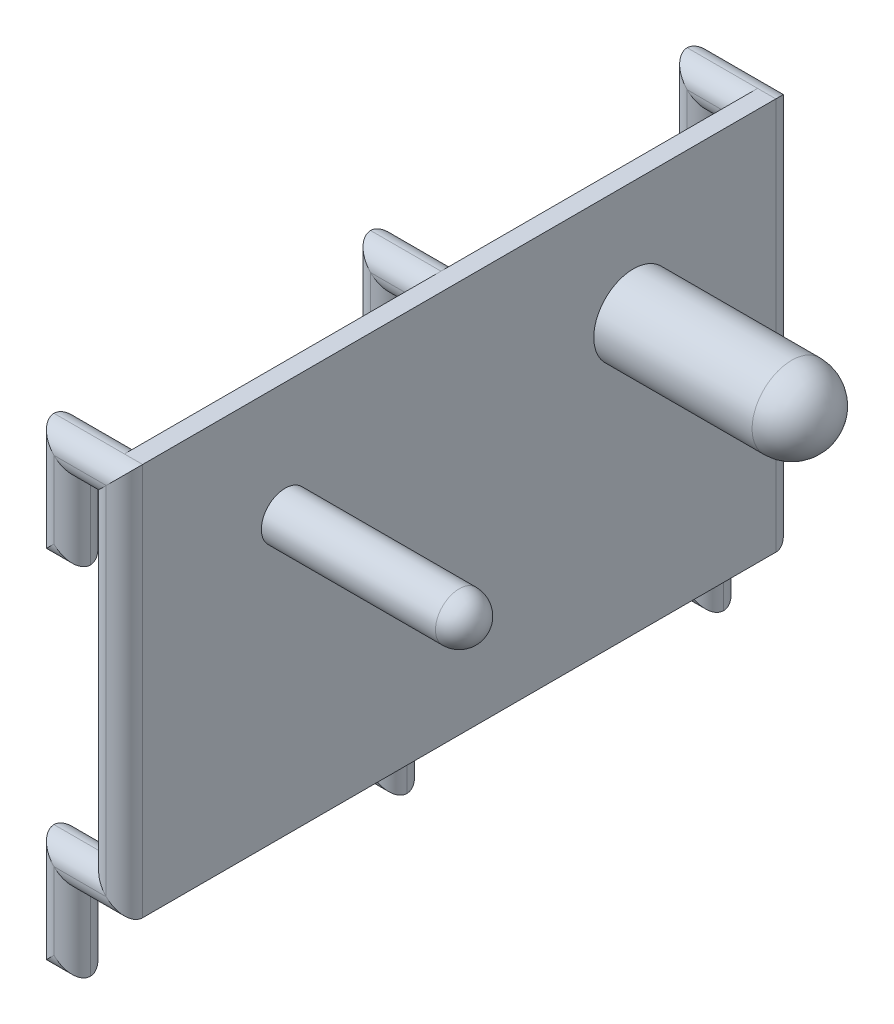
from build123d import *
from OCP.BRepFilletAPI import BRepFilletAPI_MakeFillet

# Parameters (mm, degrees)
EXTRU_MINCE1_DEPTH           = 2.3
CONG_1_R                     = 2.3
ESQUISSE2_W                  = 80
ESQUISSE2_H                  = 49.6
BOSS_EXTRU_1_DEPTH           = 2.3
R_P_TITION_START             = 77.7
R_P_TITION_LIN_AIRE1_DEPTH   = 4.6
R_P_TITION_START_2           = 37.7
R_P_TITION_LIN_AIRE1_2_DEPTH = 4.6
CONG_2_R                     = 2.3
ESQUISSE3_R                  = 3
ESQUISSE3_R_2                = 5
BOSS_EXTRU_2_DEPTH           = 25
CONG_5_R1                    = 3
CONG_5_R2                    = 5


# Read off the part's stored shape, not the designer's step: Répétition linéaire1
with BuildPart() as part:
    # Esquisse1 → Extru.-Mince1 (new, symmetric)
    with BuildSketch(Plane.XY):
        Polygon((-4.3, -57), (-4.3, -47.3), (2.3, -47.3), (2.3, 2.3), (-8.9, 2.3), (-8.9, -12), (-4.3, -12), (-4.3, -2.3), (-2.3, -2.3), (-2.3, -42.7), (-8.9, -42.7), (-8.9, -57), align=None)
    extrude(amount=EXTRU_MINCE1_DEPTH, both=True)

    # Congé1
    cong_1_edges = [part.edges().sort_by_distance(p)[0] for p in [
        (-6.6, -57, -2.3),
        (-4.3, -52.15, -2.3),
        (-1, -47.3, -2.3),
        (2.3, -22.5, -2.3),
        (-3.3, 2.3, -2.3),
        (-8.9, -4.85, -2.3),
        (-6.6, -12, -2.3),
        (-4.3, -7.15, -2.3),
        (-3.3, -2.3, -2.3),
        (-2.3, -22.5, -2.3),
        (-5.6, -42.7, -2.3),
        (-8.9, -49.85, -2.3),
        (-5.6, -42.7, 2.3),
        (-2.3, -22.5, 2.3),
        (-3.3, -2.3, 2.3),
        (-4.3, -7.15, 2.3),
        (-6.6, -12, 2.3),
        (-8.9, -4.85, 2.3),
        (-3.3, 2.3, 2.3),
        (2.3, -22.5, 2.3),
        (-1, -47.3, 2.3),
        (-4.3, -52.15, 2.3),
        (-6.6, -57, 2.3),
        (-8.9, -49.85, 2.3),
    ]]
    fillet(cong_1_edges, radius=CONG_1_R - 0.0001)  # a hair under: the kernel refuses the full size

    # Esquisse2 → Boss.-Extru.1 (add)
    with BuildSketch(Plane(origin=(0, 0, 0), x_dir=(0, 0, -1), z_dir=(1, 0, 0))):
        with Locations((-40, -22.5)):
            Rectangle(ESQUISSE2_W, ESQUISSE2_H)
    extrude(amount=BOSS_EXTRU_1_DEPTH)

    # Répétition linéaire1 outline → Répétition linéaire1 (add)
    with BuildSketch(Plane.XY.offset(R_P_TITION_START)):
        Polygon((-8.9, 2.3), (-8.9, -12), (-4.3, -12), (-4.3, -2.3), (-2.3, -2.3), (-2.3, -42.7), (-8.9, -42.7), (-8.9, -57), (-4.3, -57), (-4.3, -47.3), (2.3, -47.3), (2.3, 2.3), align=None)
    extrude(amount=R_P_TITION_LIN_AIRE1_DEPTH)

    # R_p_tition lin_aire1 2 outline → R_p_tition lin_aire1 2 (add)
    with BuildSketch(Plane.XY.offset(R_P_TITION_START_2)):
        Polygon((0, 2.3), (-8.9, 2.3), (-8.9, -12), (-4.3, -12), (-4.3, -2.3), (-2.3, -2.3), (-2.3, -42.7), (-8.9, -42.7), (-8.9, -57), (-4.3, -57), (-4.3, -47.3), (0, -47.3), align=None)
    extrude(amount=R_P_TITION_LIN_AIRE1_2_DEPTH)

    # Congé2
    cong_2_edges = [part.edges().sort_by_distance(p)[0] for p in [
        (2.3, -22.5, 82.3),
        (-1, -47.3, 82.3),
        (-3.3, 2.3, 82.3),
        (-4.45, 2.3, 77.7),
        (-2.15, -47.3, 77.7),
        (-4.3, -52.15, 77.7),
        (-6.6, -57, 77.7),
        (-6.6, -12, 77.7),
        (-8.9, -4.85, 77.7),
        (-8.9, -49.85, 77.7),
        (-6.6, -57, 82.3),
        (-4.3, -52.15, 82.3),
        (-8.9, -4.85, 82.3),
        (-6.6, -12, 82.3),
        (-4.3, -7.15, 77.7),
        (-3.3, -2.3, 77.7),
        (-2.3, -22.5, 77.7),
        (-5.6, -42.7, 77.7),
        (-8.9, -49.85, 82.3),
        (-4.3, -7.15, 82.3),
        (-3.3, -2.3, 82.3),
        (-2.3, -22.5, 82.3),
        (-5.6, -42.7, 82.3),
        (-2.15, -47.3, 42.3),
        (-4.45, 2.3, 42.3),
        (-4.3, -7.15, 42.3),
        (-3.3, -2.3, 42.3),
        (-2.3, -22.5, 42.3),
        (-5.6, -42.7, 42.3),
        (-8.9, -49.85, 42.3),
        (-4.45, 2.3, 37.7),
        (-2.15, -47.3, 37.7),
        (-4.3, -52.15, 37.7),
        (-6.6, -57, 37.7),
        (-6.6, -12, 37.7),
        (-8.9, -4.85, 37.7),
        (-8.9, -49.85, 37.7),
        (-6.6, -57, 42.3),
        (-4.3, -52.15, 42.3),
        (-8.9, -4.85, 42.3),
        (-6.6, -12, 42.3),
        (-4.3, -7.15, 37.7),
        (-3.3, -2.3, 37.7),
        (-2.3, -22.5, 37.7),
        (-5.6, -42.7, 37.7),
    ]]
    fillet(cong_2_edges, radius=CONG_2_R - 0.0001)  # a hair under: the kernel refuses the full size

    # Esquisse3 → Boss.-Extru.2 (add)
    with BuildSketch(Plane(origin=(2.3, 0, 0), x_dir=(0, 0, -1), z_dir=(1, 0, 0))):
        with Locations((-62, -12.3)):
            Circle(ESQUISSE3_R)
        with Locations((-18, -12.3)):
            Circle(ESQUISSE3_R_2)
    extrude(amount=BOSS_EXTRU_2_DEPTH)

    # Congé5: one fillet with a radius per group of edges: ONE call of the kernel's fillet builder (fillet() takes one radius for all edges)
    cong_5_edges_1 = [part.edges().sort_by_distance(p)[0] for p in [
        (27.3, -12.3, 65),
    ]]
    cong_5_edges_2 = [part.edges().sort_by_distance(p)[0] for p in [
        (27.3, -12.3, 23),
    ]]
    cong_5 = BRepFilletAPI_MakeFillet(part.part.solid().wrapped)
    for e in cong_5_edges_1:
        cong_5.Add(CONG_5_R1, e.wrapped)
    for e in cong_5_edges_2:
        cong_5.Add(CONG_5_R2, e.wrapped)
    add(Compound.cast(cong_5.Shape()), mode=Mode.REPLACE)


solid = part.part
